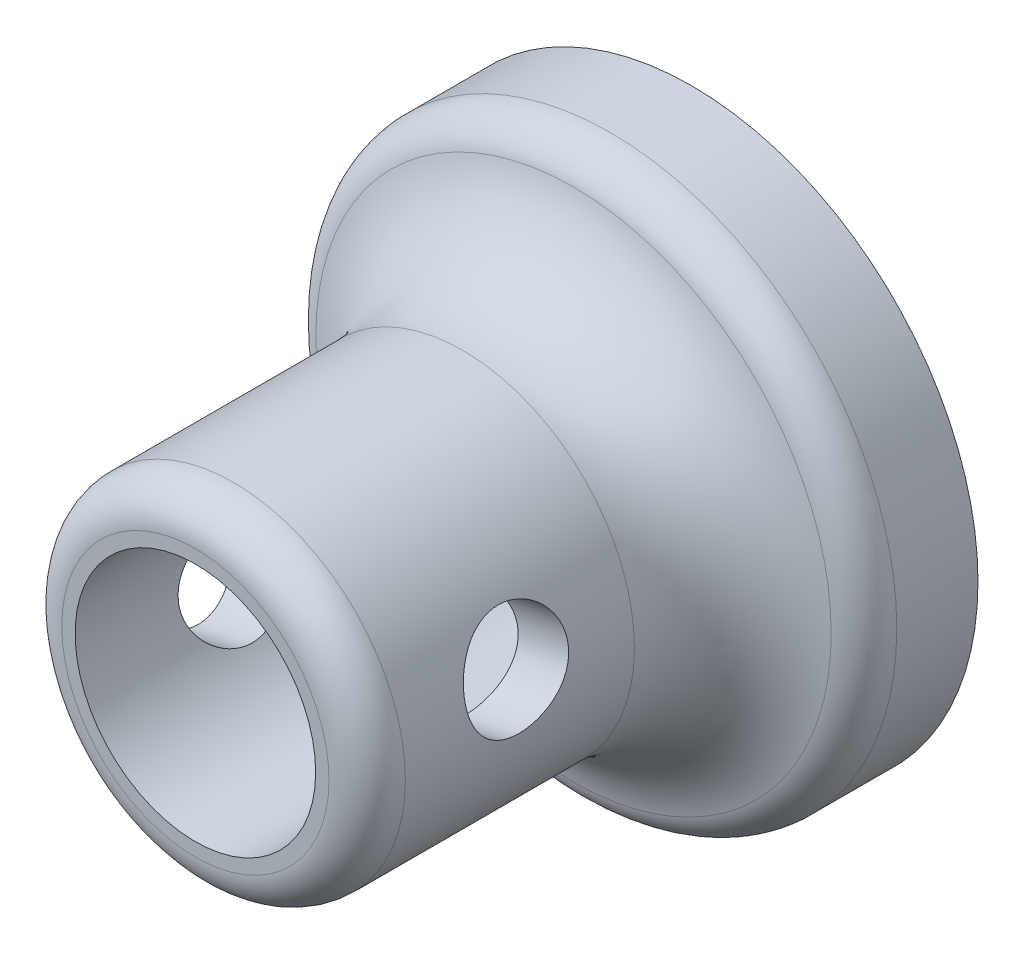
from build123d import *

# Parameters (mm, degrees)
SKETCH_6_R          = 7.5
EXTRUDE_1_DEPTH     = 3
SKETCH_7_R          = 4.5
SKETCH_7_R_2        = 3.15
EXTRUDE_2_DEPTH     = 10
FILLET_1_R          = 3
SKETCH_9_R          = 1.65
CUT_EXTRUDE_1_DEPTH = 3
FILLET_2_R          = 1
SKETCH_10_R         = 1.35
CUT_EXTRUDE_2_DEPTH = 37.90351326


with BuildPart() as part:
    # 草图6 → 凸台-拉伸1 (new body)
    with BuildSketch(Plane.XY):
        with Locations((18.143108258, 29.936835998)):
            Circle(SKETCH_6_R)
    extrude(amount=EXTRUDE_1_DEPTH)

    # 草图7 → 凸台-拉伸2 (add)
    with BuildSketch(Plane.XY.offset(3)):
        with Locations((18.143108258, 29.936835998)):
            Circle(SKETCH_7_R)
        with Locations((18.143108258, 29.936835998)):
            Circle(SKETCH_7_R_2, mode=Mode.SUBTRACT)
    extrude(amount=EXTRUDE_2_DEPTH)

    # 圆角1
    fillet_1_edges = [part.edges().sort_by_distance(p)[0] for p in [
        (13.643108258, 29.936835998, 3),
    ]]
    fillet(fillet_1_edges, radius=FILLET_1_R - 0.0001)  # a hair under: the kernel refuses the full size

    # 草图9 → 切除-拉伸1 (cut)
    with BuildSketch(Plane.XY.offset(3)):
        with Locations((18.143108258, 29.936835998)):
            Circle(SKETCH_9_R)
    extrude(amount=-CUT_EXTRUDE_1_DEPTH, mode=Mode.SUBTRACT)

    # 圆角2
    fillet_2_edges = [part.edges().sort_by_distance(p)[0] for p in [
        (10.643108258, 29.936835998, 3),
        (13.643108258, 29.936835998, 13),
    ]]
    fillet(fillet_2_edges, radius=FILLET_2_R)

    # 草图10 → 切除-拉伸2 (cut, through all)
    with BuildSketch(Plane(origin=(18.921476442, 3.905687751, 0), x_dir=(0, 0, 1), z_dir=(-0.9793537694565077, -0.20215388754938593, 0))):
        with Locations(Location((9, 25.651053313, 0), (0, 0, 270))):
            Circle(SKETCH_10_R)
    extrude(amount=-CUT_EXTRUDE_2_DEPTH, mode=Mode.SUBTRACT)


solid = part.part
